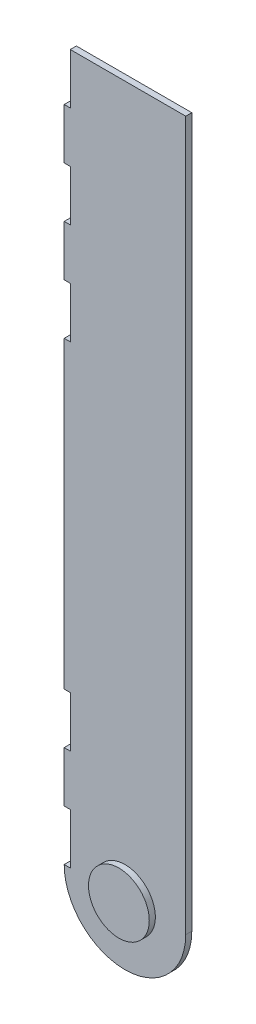
from build123d import *

# Parameters (mm, degrees)
ESQUISSE1_W             = 60
ESQUISSE1_H             = 380
BOSS_EXTRU_1_DEPTH      = 3
CONG_1_R                = 30
ESQUISSE2_W             = 3
ESQUISSE2_H             = 25
ENL_V_MAT_EXTRU_1_DEPTH = 3
ESQUISSE3_R             = 15
BOSS_EXTRU_2_DEPTH      = 3
ESQUISSE4_W             = 3
ESQUISSE4_H             = 25
ENL_V_MAT_EXTRU_2_DEPTH = 3


with BuildPart() as part:
    # Esquisse1 → Boss.-Extru.1 (new body)
    with BuildSketch(Plane.XY):
        with Locations((30, 190)):
            Rectangle(ESQUISSE1_W, ESQUISSE1_H)
    extrude(amount=BOSS_EXTRU_1_DEPTH)

    # Congé1
    cong_1_edges = [part.edges().sort_by_distance(p)[0] for p in [
        (0, 0, 1.5),
        (60, 0, 1.5),
    ]]
    fillet(cong_1_edges, radius=CONG_1_R - 0.0001)  # a hair under: the kernel refuses the full size

    # Esquisse2 → Enlèv. mat.-Extru.1 (cut)
    with BuildSketch(Plane.XY.offset(3)):
        with Locations((1.5, 367.5)):
            Rectangle(ESQUISSE2_W, ESQUISSE2_H)
        with Locations((1.5, 317.5)):
            Rectangle(ESQUISSE2_W, ESQUISSE2_H)
        with Locations((1.5, 267.5)):
            Rectangle(ESQUISSE2_W, ESQUISSE2_H)
    extrude(amount=-ENL_V_MAT_EXTRU_1_DEPTH, mode=Mode.SUBTRACT)

    # Esquisse3 → Boss.-Extru.2 (add)
    with BuildSketch(Plane.XY.offset(3)):
        with Locations(Location((30, 30, 0), (0, 0, 180))):
            Circle(ESQUISSE3_R)
    extrude(amount=BOSS_EXTRU_2_DEPTH)

    # Esquisse4 → Enlèv. mat.-Extru.2 (cut)
    with BuildSketch(Plane.XY.offset(3)):
        with Locations((1.5, 42.5)):
            Rectangle(ESQUISSE4_W, ESQUISSE4_H)
        with Locations((1.5, 92.5)):
            Rectangle(ESQUISSE4_W, ESQUISSE4_H)
    extrude(amount=-ENL_V_MAT_EXTRU_2_DEPTH, mode=Mode.SUBTRACT)


solid = part.part
